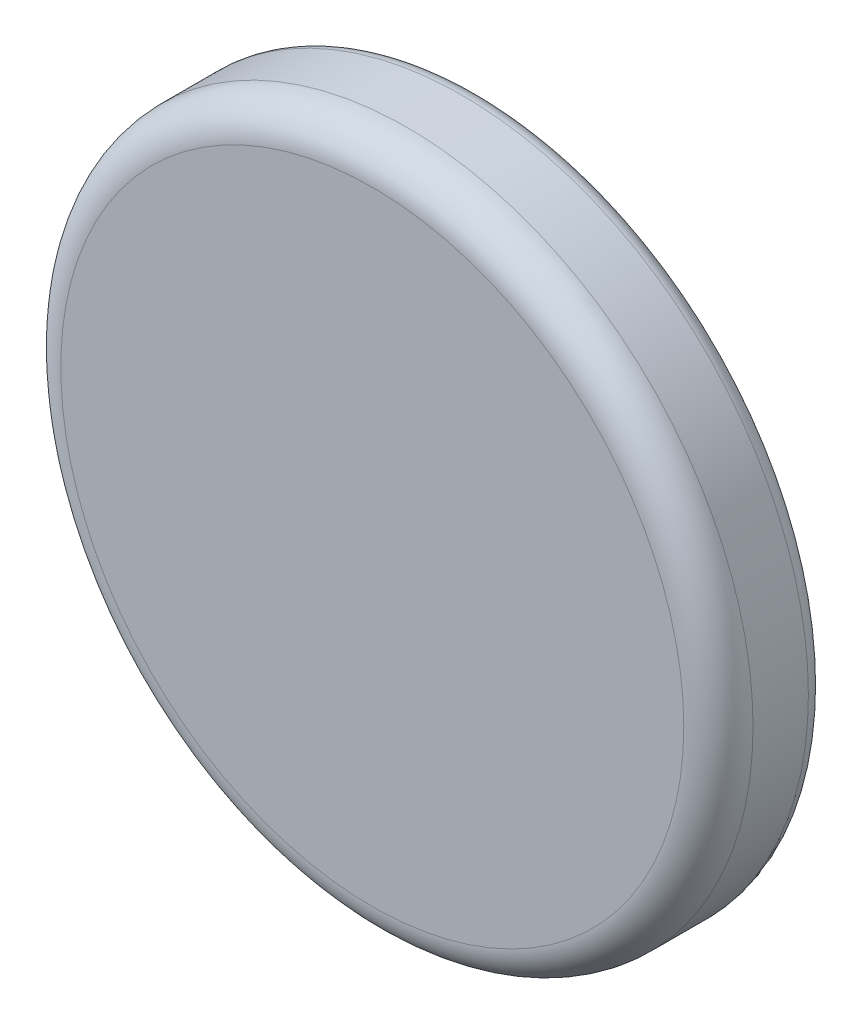
from build123d import *

# Parameters (mm, degrees)
SKETCH_1_R            = 2.5
EXTRUDE_19_DEPTH      = 2.1
EXTRUDE_START         = 1
SKETCH_1_24_R         = 9
SKETCH_1_24_R_2       = 2.5
EXTRUDE_20_DEPTH      = 1
EXTRUDE_21_DEPTH      = 1
EXTRUDE_21_DEPTH_BACK = 2.1
SKETCH_1_25_R         = 10
SKETCH_1_25_R_2       = 9
FILLET_1_R            = 1
FILLET_2_R            = 0.5
FILLET_3_R            = 0.5
FILLET_4_R            = 1


with BuildPart() as part:
    # 草图1 → 凸台-拉伸19 (new body)
    with BuildSketch(Plane.XY):
        Circle(SKETCH_1_R)
        Polygon((0.57030636, 0.535854496), (0.57030636, 2.2), (-0.57030636, 2.2), (-0.57030636, 0.535854496), (-2.2, 0.535854496), (-2.2, -0.535854496), (-0.57030636, -0.535854496), (-0.57030636, -2.2), (0.57030636, -2.2), (0.57030636, -0.535854496), (2.2, -0.535854496), (2.2, 0.535854496), align=None, mode=Mode.SUBTRACT)
    extrude(amount=-EXTRUDE_19_DEPTH)

    # 草图1<24> → 凸台-拉伸20 (add)
    # profile 1 of 4: a face of its own
    with BuildSketch(Plane.XY.offset(EXTRUDE_START)):
        Circle(SKETCH_1_24_R)
        Circle(SKETCH_1_24_R_2, mode=Mode.SUBTRACT)
    # profile 2 of 4: a face of its own
    with BuildSketch(Plane.XY.offset(EXTRUDE_START)):
        Circle(SKETCH_1_24_R_2)
        Polygon((0.57030636, 0.535854496), (0.57030636, 2.2), (-0.57030636, 2.2), (-0.57030636, 0.535854496), (-2.2, 0.535854496), (-2.2, -0.535854496), (-0.57030636, -0.535854496), (-0.57030636, -2.2), (0.57030636, -2.2), (0.57030636, -0.535854496), (2.2, -0.535854496), (2.2, 0.535854496), align=None, mode=Mode.SUBTRACT)
    # profile 3 of 4: a face of its own
    with BuildSketch(Plane.XY.offset(EXTRUDE_START)):
        Polygon((0.57030636, 0.535854496), (2.2, 0.535854496), (2.2, -0.535854496), (0.57030636, -0.535854496), (0.57030636, -2.2), (-0.57030636, -2.2), (-0.57030636, -0.535854496), (-2.2, -0.535854496), (-2.2, 0.535854496), (-0.57030636, 0.535854496), (-0.57030636, 2.2), (0.57030636, 2.2), align=None)
        Polygon((0.37030636, -0.335854496), (2, -0.335854496), (2, 0.335854496), (0.37030636, 0.335854496), (0.37030636, 2), (-0.37030636, 2), (-0.37030636, 0.335854496), (-2, 0.335854496), (-2, -0.335854496), (-0.37030636, -0.335854496), (-0.37030636, -2), (0.37030636, -2), align=None, mode=Mode.SUBTRACT)
    # profile 4 of 4: a face of its own
    with BuildSketch(Plane.XY.offset(EXTRUDE_START)):
        Polygon((0.37030636, -2), (0.37030636, -0.335854496), (2, -0.335854496), (2, 0.335854496), (0.37030636, 0.335854496), (0.37030636, 2), (-0.37030636, 2), (-0.37030636, 0.335854496), (-2, 0.335854496), (-2, -0.335854496), (-0.37030636, -0.335854496), (-0.37030636, -2), align=None)
    extrude(amount=-EXTRUDE_20_DEPTH)

    # 草图1<25> → 凸台-拉伸21 (add, two sides: drawn at the far end of the back side and taken through both)
    with BuildSketch(Plane.XY.offset(-EXTRUDE_21_DEPTH_BACK)):
        Circle(SKETCH_1_25_R)
        Circle(SKETCH_1_25_R_2, mode=Mode.SUBTRACT)
    extrude(amount=EXTRUDE_21_DEPTH + EXTRUDE_21_DEPTH_BACK)

    # 圆角1
    fillet_1_edges = [part.edges().sort_by_distance(p)[0] for p in [
        (-10, 0, 1),
    ]]
    fillet(fillet_1_edges, radius=FILLET_1_R - 0.0001)  # a hair under: the kernel refuses the full size

    # 圆角2
    fillet_2_edges = [part.edges().sort_by_distance(p)[0] for p in [
        (-10, 0, -2.1),
    ]]
    fillet(fillet_2_edges, radius=FILLET_2_R)

    # 圆角3
    fillet_3_edges = [part.edges().sort_by_distance(p)[0] for p in [
        (-9, 0, -2.1),
    ]]
    fillet(fillet_3_edges, radius=FILLET_3_R - 0.0001)  # a hair under: the kernel refuses the full size

    # 圆角4
    fillet_4_edges = [part.edges().sort_by_distance(p)[0] for p in [
        (-9, 0, 0),
    ]]
    fillet(fillet_4_edges, radius=FILLET_4_R)


solid = part.part
